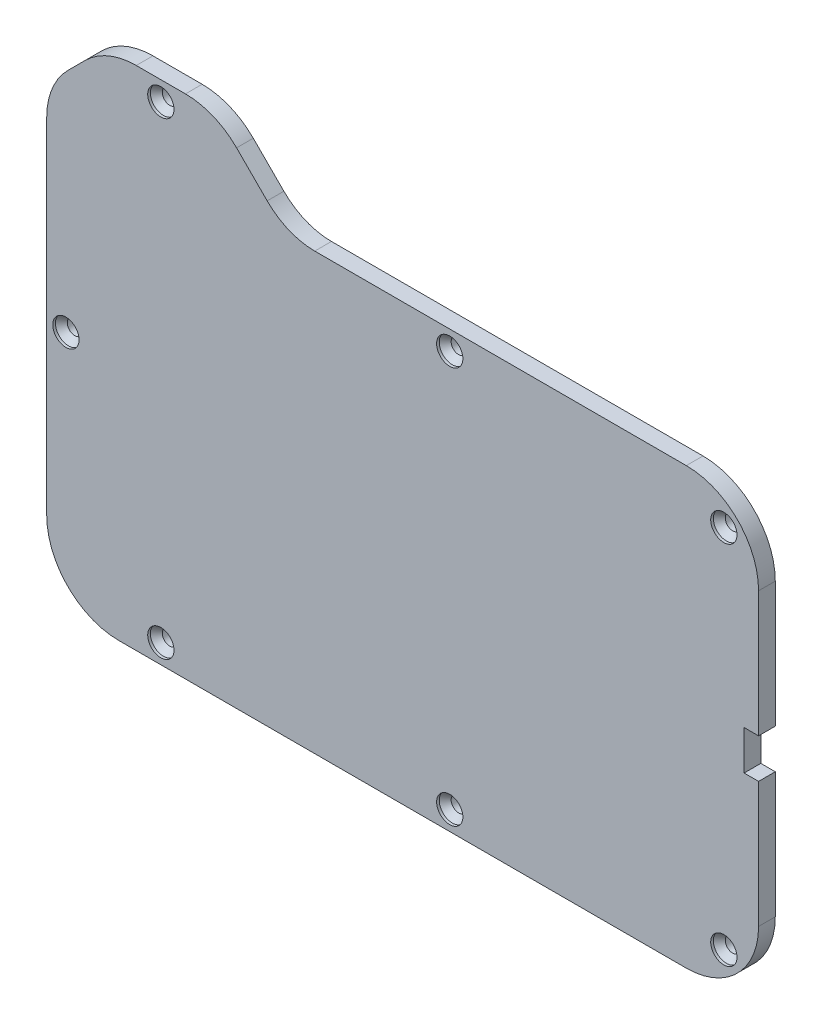
from build123d import *

# Parameters (mm, degrees)
SKETCH1_R                    = 1.425
BOSS_EXTRUDE1_DEPTH          = 3.175
SKETCH2_R                    = 2.5
CUT_EXTRUDE1_DEPTH           = 0.5
SKETCH3_R                    = 2.5
CUT_EXTRUDE2_DEPTH           = 1.2
CUT_EXTRUDE2_DRAFT           = -42
CUT_EXTRUDE2_PROFILE_2_DEPTH = 1.2
CUT_EXTRUDE2_PROFILE_2_DRAFT = -42
CUT_EXTRUDE2_PROFILE_3_DEPTH = 1.2
CUT_EXTRUDE2_PROFILE_3_DRAFT = -42
CUT_EXTRUDE2_PROFILE_4_DEPTH = 1.2
CUT_EXTRUDE2_PROFILE_4_DRAFT = -42
CUT_EXTRUDE2_PROFILE_5_DEPTH = 1.2
CUT_EXTRUDE2_PROFILE_5_DRAFT = -42
CUT_EXTRUDE2_PROFILE_6_DEPTH = 1.2
CUT_EXTRUDE2_PROFILE_6_DRAFT = -42
CUT_EXTRUDE2_PROFILE_7_DEPTH = 1.2
CUT_EXTRUDE2_PROFILE_7_DRAFT = -42


with BuildPart() as part:
    # Sketch1 → Boss-Extrude1 (new body)
    with BuildSketch(Plane.XY):
        with BuildLine():
            Line((143.808069079, 20.460501739), (143.808069079, 44.360501739))
            Line((143.808069079, 44.360501739), (141.058069079, 44.360501739))
            Line((141.058069079, 44.360501739), (141.058069079, 51.860501739))
            Line((141.058069079, 51.860501739), (143.808069079, 51.860501739))
            Line((143.808069079, 51.860501739), (143.808069079, 75.76050174))
            ThreePointArc((143.808069079, 75.76050174), (139.780787321, 85.483219981), (130.058069079, 89.51050174))
            Line((130.058069079, 89.51050174), (59.375183039, 89.51050174))
            ThreePointArc((59.375183039, 89.51050174), (54.476835105, 90.484843724), (50.32421624, 93.259534941))
            Line((50.32421624, 93.259534941), (44.500531199, 99.083219981))
            ThreePointArc((44.500531199, 99.083219981), (40.039710153, 102.063845312), (34.777812958, 103.11050174))
            Line((34.777812958, 103.11050174), (25.414810921, 103.11050174))
            ThreePointArc((25.414810921, 103.11050174), (20.152913726, 102.063845312), (15.69209268, 99.083219981))
            Line((15.69209268, 99.083219981), (12.411836559, 95.80296386))
            ThreePointArc((12.411836559, 95.80296386), (9.431211228, 91.342142814), (8.3845548, 86.080245619))
            Line((8.3845548, 86.080245619), (8.3845548, 20.460501739))
            ThreePointArc((8.3845548, 20.460501739), (12.411836559, 10.737783497), (22.1345548, 6.710501739))
            Line((22.1345548, 6.710501739), (130.058069079, 6.710501739))
            ThreePointArc((130.058069079, 6.710501739), (139.780787321, 10.737783497), (143.808069079, 20.460501739))
        make_face()
        with Locations((12.0345548, 52.470373679)):
            Circle(SKETCH1_R, mode=Mode.SUBTRACT)
        with Locations((30.09631194, 99.46050174)):
            Circle(SKETCH1_R, mode=Mode.SUBTRACT)
        with Locations((85.053742799, 85.86050174)):
            Circle(SKETCH1_R, mode=Mode.SUBTRACT)
        with Locations((137.199847569, 82.902280229)):
            Circle(SKETCH1_R, mode=Mode.SUBTRACT)
        with Locations((137.199847569, 13.318723249)):
            Circle(SKETCH1_R, mode=Mode.SUBTRACT)
        with Locations((85.053742799, 10.36050174)):
            Circle(SKETCH1_R, mode=Mode.SUBTRACT)
        with Locations((30.09631194, 10.36050174)):
            Circle(SKETCH1_R, mode=Mode.SUBTRACT)
    extrude(amount=BOSS_EXTRUDE1_DEPTH)

    # Sketch2 → Cut-Extrude1 (cut)
    with BuildSketch(Plane.XY.offset(3.175)):
        with Locations((137.199847569, 82.902280229)):
            Circle(SKETCH2_R)
        with Locations((137.199847569, 13.318723249)):
            Circle(SKETCH2_R)
        with Locations((85.053742799, 10.36050174)):
            Circle(SKETCH2_R)
        with Locations((30.09631194, 10.36050174)):
            Circle(SKETCH2_R)
        with Locations((12.0345548, 52.470373679)):
            Circle(SKETCH2_R)
        with Locations((30.09631194, 99.46050174)):
            Circle(SKETCH2_R)
        with Locations((85.053742799, 85.86050174)):
            Circle(SKETCH2_R)
    extrude(amount=-CUT_EXTRUDE1_DEPTH, mode=Mode.SUBTRACT)


with BuildPart() as cut_extrude2_tool:
    # Sketch3 → Cut-Extrude2 (with draft: the straight prism first)
    with BuildSketch(Plane.XY.offset(2.675)):
        with Locations((85.053742799, 10.36050174)):
            Circle(SKETCH3_R)
    extrude(amount=-CUT_EXTRUDE2_DEPTH)
    # Cut-Extrude2: the draft: its side faces are tilted about the plane it starts from
    cut_extrude2_sides = [cut_extrude2_tool.faces().sort_by_distance(p)[0] for p in [
        (82.553742799, 10.36050174, 2.075),
    ]]
    draft(cut_extrude2_sides, Plane.XY.offset(2.675), CUT_EXTRUDE2_DRAFT)


with BuildPart() as part_1:
    add(part.part)

    # Cut-Extrude2: cut by cut_extrude2_tool
    add(cut_extrude2_tool.part, mode=Mode.SUBTRACT)


with BuildPart() as cut_extrude2_profile_2_tool:
    # Sketch3 → Cut-Extrude2 profile 2 (with draft: the straight prism first)
    with BuildSketch(Plane.XY.offset(2.675)):
        with Locations((30.09631194, 10.36050174)):
            Circle(SKETCH3_R)
    extrude(amount=-CUT_EXTRUDE2_PROFILE_2_DEPTH)
    # Cut-Extrude2 profile 2: the draft: its side faces are tilted about the plane it starts from
    cut_extrude2_profile_2_sides = [cut_extrude2_profile_2_tool.faces().sort_by_distance(p)[0] for p in [
        (27.59631194, 10.36050174, 2.075),
    ]]
    draft(cut_extrude2_profile_2_sides, Plane.XY.offset(2.675), CUT_EXTRUDE2_PROFILE_2_DRAFT)


with BuildPart() as part_2:
    add(part_1.part)

    # Cut-Extrude2 profile 2: cut by cut_extrude2_profile_2_tool
    add(cut_extrude2_profile_2_tool.part, mode=Mode.SUBTRACT)


with BuildPart() as cut_extrude2_profile_3_tool:
    # Sketch3 → Cut-Extrude2 profile 3 (with draft: the straight prism first)
    with BuildSketch(Plane.XY.offset(2.675)):
        with Locations((12.0345548, 52.470373679)):
            Circle(SKETCH3_R)
    extrude(amount=-CUT_EXTRUDE2_PROFILE_3_DEPTH)
    # Cut-Extrude2 profile 3: the draft: its side faces are tilted about the plane it starts from
    cut_extrude2_profile_3_sides = [cut_extrude2_profile_3_tool.faces().sort_by_distance(p)[0] for p in [
        (9.5345548, 52.470373679, 2.075),
    ]]
    draft(cut_extrude2_profile_3_sides, Plane.XY.offset(2.675), CUT_EXTRUDE2_PROFILE_3_DRAFT)


with BuildPart() as part_3:
    add(part_2.part)

    # Cut-Extrude2 profile 3: cut by cut_extrude2_profile_3_tool
    add(cut_extrude2_profile_3_tool.part, mode=Mode.SUBTRACT)


with BuildPart() as cut_extrude2_profile_4_tool:
    # Sketch3 → Cut-Extrude2 profile 4 (with draft: the straight prism first)
    with BuildSketch(Plane.XY.offset(2.675)):
        with Locations((30.09631194, 99.46050174)):
            Circle(SKETCH3_R)
    extrude(amount=-CUT_EXTRUDE2_PROFILE_4_DEPTH)
    # Cut-Extrude2 profile 4: the draft: its side faces are tilted about the plane it starts from
    cut_extrude2_profile_4_sides = [cut_extrude2_profile_4_tool.faces().sort_by_distance(p)[0] for p in [
        (27.59631194, 99.46050174, 2.075),
    ]]
    draft(cut_extrude2_profile_4_sides, Plane.XY.offset(2.675), CUT_EXTRUDE2_PROFILE_4_DRAFT)


with BuildPart() as part_4:
    add(part_3.part)

    # Cut-Extrude2 profile 4: cut by cut_extrude2_profile_4_tool
    add(cut_extrude2_profile_4_tool.part, mode=Mode.SUBTRACT)


with BuildPart() as cut_extrude2_profile_5_tool:
    # Sketch3 → Cut-Extrude2 profile 5 (with draft: the straight prism first)
    with BuildSketch(Plane.XY.offset(2.675)):
        with Locations((85.053742799, 85.86050174)):
            Circle(SKETCH3_R)
    extrude(amount=-CUT_EXTRUDE2_PROFILE_5_DEPTH)
    # Cut-Extrude2 profile 5: the draft: its side faces are tilted about the plane it starts from
    cut_extrude2_profile_5_sides = [cut_extrude2_profile_5_tool.faces().sort_by_distance(p)[0] for p in [
        (82.553742799, 85.86050174, 2.075),
    ]]
    draft(cut_extrude2_profile_5_sides, Plane.XY.offset(2.675), CUT_EXTRUDE2_PROFILE_5_DRAFT)


with BuildPart() as part_5:
    add(part_4.part)

    # Cut-Extrude2 profile 5: cut by cut_extrude2_profile_5_tool
    add(cut_extrude2_profile_5_tool.part, mode=Mode.SUBTRACT)


with BuildPart() as cut_extrude2_profile_6_tool:
    # Sketch3 → Cut-Extrude2 profile 6 (with draft: the straight prism first)
    with BuildSketch(Plane.XY.offset(2.675)):
        with Locations((137.199847569, 82.902280229)):
            Circle(SKETCH3_R)
    extrude(amount=-CUT_EXTRUDE2_PROFILE_6_DEPTH)
    # Cut-Extrude2 profile 6: the draft: its side faces are tilted about the plane it starts from
    cut_extrude2_profile_6_sides = [cut_extrude2_profile_6_tool.faces().sort_by_distance(p)[0] for p in [
        (134.699847569, 82.902280229, 2.075),
    ]]
    draft(cut_extrude2_profile_6_sides, Plane.XY.offset(2.675), CUT_EXTRUDE2_PROFILE_6_DRAFT)


with BuildPart() as part_6:
    add(part_5.part)

    # Cut-Extrude2 profile 6: cut by cut_extrude2_profile_6_tool
    add(cut_extrude2_profile_6_tool.part, mode=Mode.SUBTRACT)


with BuildPart() as cut_extrude2_profile_7_tool:
    # Sketch3 → Cut-Extrude2 profile 7 (with draft: the straight prism first)
    with BuildSketch(Plane.XY.offset(2.675)):
        with Locations((137.199847569, 13.318723249)):
            Circle(SKETCH3_R)
    extrude(amount=-CUT_EXTRUDE2_PROFILE_7_DEPTH)
    # Cut-Extrude2 profile 7: the draft: its side faces are tilted about the plane it starts from
    cut_extrude2_profile_7_sides = [cut_extrude2_profile_7_tool.faces().sort_by_distance(p)[0] for p in [
        (134.699847569, 13.318723249, 2.075),
    ]]
    draft(cut_extrude2_profile_7_sides, Plane.XY.offset(2.675), CUT_EXTRUDE2_PROFILE_7_DRAFT)


with BuildPart() as part_7:
    add(part_6.part)

    # Cut-Extrude2 profile 7: cut by cut_extrude2_profile_7_tool
    add(cut_extrude2_profile_7_tool.part, mode=Mode.SUBTRACT)


solid = part_7.part
